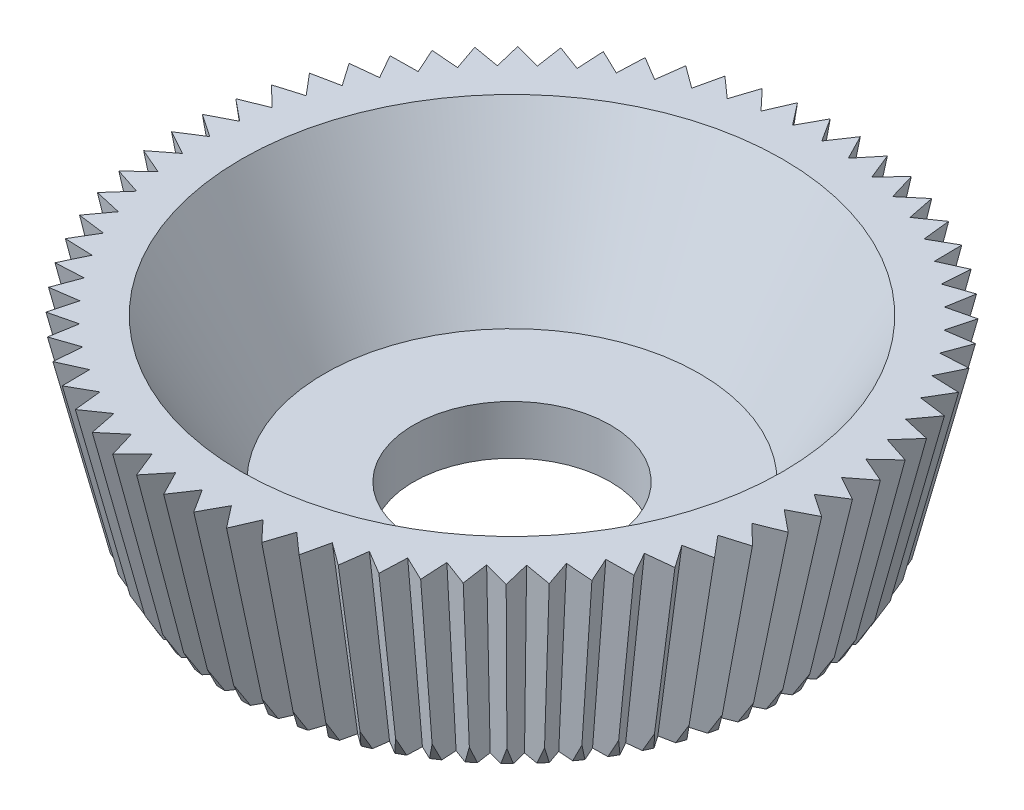
from build123d import *

# Parameters (mm, degrees)
CUT_EXTRUDE1_DEPTH = 11.649892856
CUT_EXTRUDE1_TAPER = -7
CIRPATTERN1_COUNT  = 68


with BuildPart() as part:
    # Sketch1 → Revolve1 (revolve)
    with BuildSketch(Plane.XY):
        Polygon((5.59885258, 11.07314148), (7, 13.5), (7, 15), (5.5, 15), (3.810177445, 12.07314148), (2, 12.07314148), (2, 11.07314148), align=None)
    revolve(axis=Axis((0, 11.07314148, 0), (0, 1, 0)))

    # Sketch2 → Cut-Extrude1 (cut, through all)
    with BuildSketch(Plane(origin=(0, 15, 0), x_dir=(1, 0, 0), z_dir=(0, 1, 0))):
        with BuildLine():
            ThreePointArc((0.057474451, -6.999764045), (0.55891124, -6.97765134), (1.057474451, -6.919663849))
            Line((1.057474451, -6.919663849), (0.496423012, -6.197525561))
            Line((0.496423012, -6.197525561), (0.057474451, -6.999764045))
        make_face()
    cut_extrude1 = extrude(amount=-CUT_EXTRUDE1_DEPTH, taper=CUT_EXTRUDE1_TAPER, mode=Mode.SUBTRACT)

    # CirPattern1: Cut-Extrude1 ×68 about axis
    cirpattern1_axis = Axis((0, 15, 0), (0, -1, 0))
    for i in range(1, CIRPATTERN1_COUNT):
        add(cut_extrude1.rotate(cirpattern1_axis, i * 360 / CIRPATTERN1_COUNT), mode=Mode.SUBTRACT)


solid = part.part
